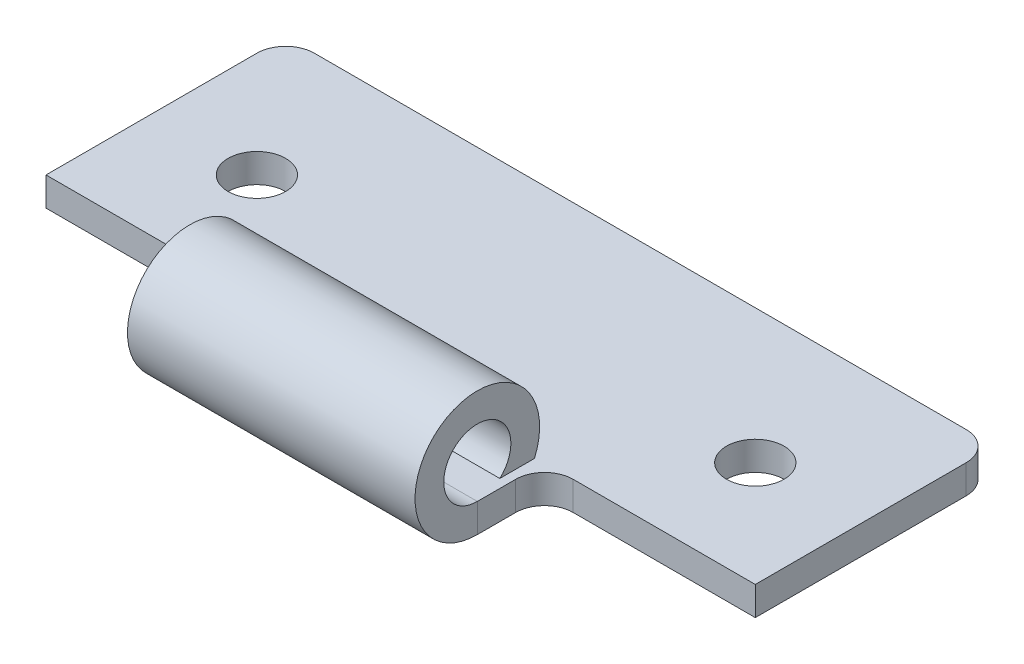
from build123d import *

# Parameters (mm, degrees)
SKETCH_1_W             = 37
SKETCH_1_H             = 14
SKETCH_1_R             = 1.5
SM_BASE_FLANGE_1_DEPTH = 1.5
SKETCH_7_W             = 2
SKETCH_7_H             = 1.5
EXTRUDE_1_DEPTH        = 15
SM_BASE_FLANGE_2_DEPTH = 15
SKETCH_11_W            = 11
SKETCH_11_H            = 1.5
CUT_EXTRUDE_1_DEPTH    = 15
FILLET_1_R             = 1.5
FILLET_2_R             = 1.5


# Sheet-metal steps are written as plain solids
with BuildPart() as part:
    # Sketch 1 → 基体-法兰1 (new body)
    with BuildSketch(Plane(origin=(0, 0, 0), x_dir=(1, 0, 0), z_dir=(0, 1, 0))):
        with Locations((18.5, 7)):
            Rectangle(SKETCH_1_W, SKETCH_1_H)
        with Locations(Location((5.5, 7, 0), (0, 0, 270))):
            Circle(SKETCH_1_R, mode=Mode.SUBTRACT)
        with Locations(Location((31.5, 7, 0), (0, 0, 270))):
            Circle(SKETCH_1_R, mode=Mode.SUBTRACT)
    extrude(amount=-SM_BASE_FLANGE_1_DEPTH)

    # 草图7 → 凸台-拉伸1 (add)
    with BuildSketch(Plane(origin=(26, 0, 0), x_dir=(0, 0, -1), z_dir=(1, 0, 0))):
        with Locations((-1, -0.75)):
            Rectangle(SKETCH_7_W, SKETCH_7_H)
    extrude(amount=-EXTRUDE_1_DEPTH)

    # 草图11 → 切除-拉伸1 (cut)
    with BuildSketch(Plane(origin=(0, 0, 0), x_dir=(1, 0, 0), z_dir=(0, 1, 0))):
        with Locations((5.5, 0.75)):
            Rectangle(SKETCH_11_W, SKETCH_11_H)
        with Locations((31.5, 0.75)):
            Rectangle(SKETCH_11_W, SKETCH_11_H)
    extrude(amount=-CUT_EXTRUDE_1_DEPTH, mode=Mode.SUBTRACT)

    # 圆角1
    fillet_1_edges = [part.edges().sort_by_distance(p)[0] for p in [
        (0, -0.75, -14),
        (37, -0.75, -14),
    ]]
    fillet(fillet_1_edges, radius=FILLET_1_R)

    # 圆角2
    fillet_2_edges = [part.edges().sort_by_distance(p)[0] for p in [
        (11, -0.75, -1.5),
        (26, -0.75, -1.5),
    ]]
    fillet(fillet_2_edges, radius=FILLET_2_R)


with BuildPart() as body_2:
    # 草图8 → 基体-法兰2 (new body)
    with BuildSketch(Plane(origin=(26, 0, 0), x_dir=(0, 0, -1), z_dir=(1, 0, 0))):
        with BuildLine():
            Line((-0.826864003, 0.451442364), (0.979303286, 0.451442364))
            ThreePointArc((0.979303286, 0.451442364), (-3.780756536, 4.468714063), (-2, -1.5))
            Line((-2, -1.5), (-2, 0))
            ThreePointArc((-2, 0), (-3.75, 1.75), (-2, 3.5))
            ThreePointArc((-2, 3.5), (-0.366755398, 2.378499856), (-0.826864003, 0.451442364))
        make_face()
    extrude(amount=-SM_BASE_FLANGE_2_DEPTH)


solid = Compound([part.part, body_2.part])
